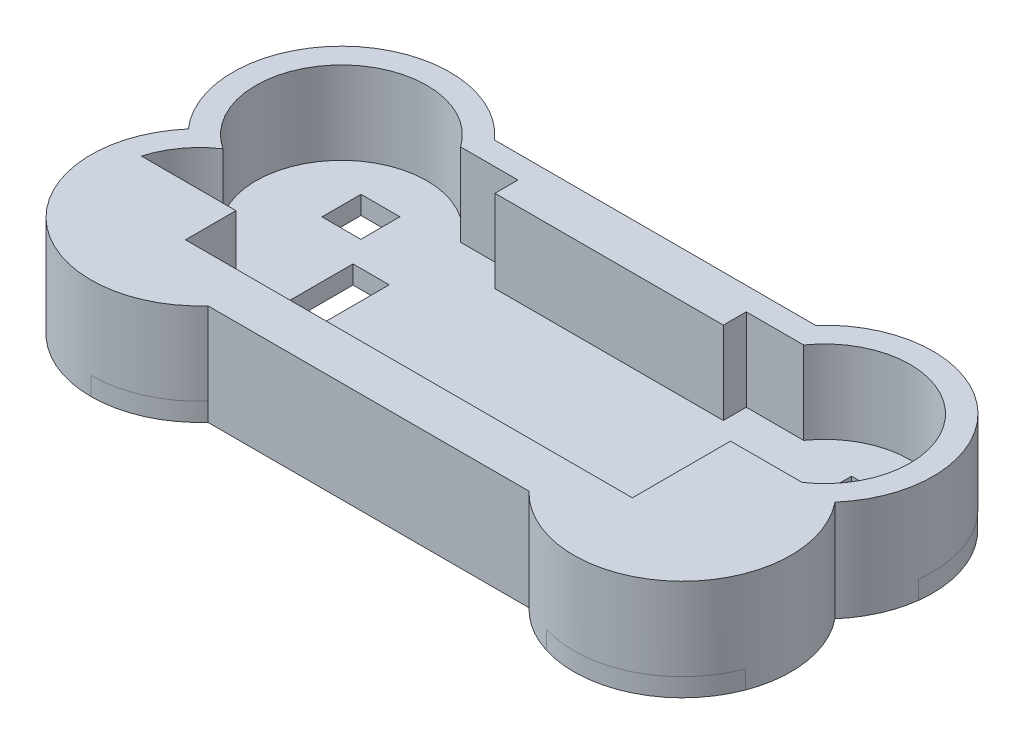
from build123d import *

# Parameters (mm, degrees)
SKETCH1_W               = 25.267998504
SKETCH1_H               = 2.54
BOSS_EXTRUDE7_DEPTH     = 9.144
BOSS_EXTRUDE9_START     = -2.032
BOSS_EXTRUDE9_OUTLINE_W = 4.303574795
BOSS_EXTRUDE9_OUTLINE_H = 4.327328355
BOSS_EXTRUDE9_DEPTH     = 2.032


# Read off the part's stored shape, not the designer's step: Boss-Extrude9
with BuildPart() as part:
    # Sketch1 → Boss-Extrude7 (new body)
    # profile 1 of 5: a face of its own
    with BuildSketch(Plane(origin=(0, 0, 0), x_dir=(1, 0, 0), z_dir=(0, 1, 0))):
        with BuildLine():
            ThreePointArc((20.091392362, -14.973938339), (36.674866164, -15.633001334), (38.077226225, 0.904209847))
            ThreePointArc((38.077226225, 0.904209847), (36.965236291, 17.810596862), (20.053933255, 16.7760568))
            Line((20.053933255, 16.7760568), (-15.464178996, 16.7760568))
            ThreePointArc((-15.464178996, 16.7760568), (-32.391267437, 17.810916917), (-33.472263124, 0.886712153))
            ThreePointArc((-33.472263124, 0.886712153), (-32.31789128, -15.981799893), (-15.439991882, -14.973938339))
            Line((-15.439991882, -14.973938339), (20.091392362, -14.973938339))
        make_face()
        with BuildLine():
            ThreePointArc((-29.65629843, 0.90105923), (-31.167264268, -13.573979358), (-16.658299233, -12.433938339))
            Line((-16.658299233, -12.433938339), (21.246557929, -12.433938339))
            ThreePointArc((21.246557929, -12.433938339), (35.496314389, -13.251428184), (34.363784281, 0.976755972))
            ThreePointArc((34.363784281, 0.976755972), (35.768086185, 15.449459714), (21.2781286, 14.2360568))
            Line((21.2781286, 14.2360568), (-16.689869904, 14.2360568))
            ThreePointArc((-16.689869904, 14.2360568), (-31.234591455, 15.407251461), (-29.65629843, 0.90105923))
        make_face(mode=Mode.SUBTRACT)
    # profile 2 of 5: a face of its own
    with BuildSketch(Plane(origin=(0, 0, 0), x_dir=(1, 0, 0), z_dir=(0, 1, 0))):
        with BuildLine():
            ThreePointArc((-33.474089865, -4.305938339), (-28.507587271, -15.489738966), (-16.658299233, -12.433938339))
            Line((-16.658299233, -12.433938339), (-10.339869904, -12.433938339))
            Line((-10.339869904, -12.433938339), (-10.339869904, -9.893938339))
            Line((-10.339869904, -9.893938339), (-16.658299233, -9.893938339))
            Line((-16.658299233, -9.893938339), (-23.008299233, -9.893938339))
            Line((-23.008299233, -9.893938339), (-23.008299233, -4.305938339))
            Line((-23.008299233, -4.305938339), (-33.474089865, -4.305938339))
        make_face()
    # profile 3 of 5: a face of its own
    with BuildSketch(Plane(origin=(0, 0, 0), x_dir=(1, 0, 0), z_dir=(0, 1, 0))):
        with Locations((2.294129348, -11.163938339)):
            Rectangle(SKETCH1_W, SKETCH1_H)
    # profile 4 of 5: a face of its own
    with BuildSketch(Plane(origin=(0, 0, 0), x_dir=(1, 0, 0), z_dir=(0, 1, 0))):
        with BuildLine():
            Line((14.9281286, -9.893938339), (14.9281286, -12.433938339))
            Line((14.9281286, -12.433938339), (21.246557929, -12.433938339))
            ThreePointArc((21.246557929, -12.433938339), (35.496314389, -13.251428184), (34.363784281, 0.976755972))
            Line((34.363784281, 0.976755972), (26.449874225, 0.976755972))
            Line((26.449874225, 0.976755972), (26.449874225, -9.893938339))
            Line((26.449874225, -9.893938339), (21.246557929, -9.893938339))
            Line((21.246557929, -9.893938339), (14.9281286, -9.893938339))
        make_face()
    # profile 5 of 5: a face of its own
    with BuildSketch(Plane(origin=(0, 0, 0), x_dir=(1, 0, 0), z_dir=(0, 1, 0))):
        with Locations((2.294129348, 12.9660568)):
            Rectangle(SKETCH1_W, SKETCH1_H)
    extrude(amount=BOSS_EXTRUDE7_DEPTH)

    # Boss-Extrude9 outline → Boss-Extrude9 (add)
    with BuildSketch(Plane(origin=(0, 0, 2.54), x_dir=(-1, 0, 0), z_dir=(0, 1, 0)).offset(BOSS_EXTRUDE9_START)):
        with BuildLine():
            ThreePointArc((-39.962274592, 8.331071624), (-40.584803359, 2.192889064), (-38.077226225, -3.444209847))
            ThreePointArc((-38.077226225, -3.444209847), (-39.980253201, -6.412725487), (-40.938977335, -9.806019581))
            ThreePointArc((-40.938977335, -9.806019581), (-34.00622148, -22.23363184), (-20.077959401, -19.316070247))
            Line((-20.077959401, -19.316070247), (-20.053939231, -19.316070247))
            Line((-20.053939231, -19.316070247), (15.464178996, -19.3160568))
            ThreePointArc((15.464178996, -19.3160568), (16.013662974, -19.895397798), (16.600434504, -20.436939861))
            ThreePointArc((16.600434504, -20.436939861), (32.922411354, -19.767481007), (33.473277412, -3.441071419))
            ThreePointArc((33.473277412, -3.441071419), (33.476154659, -3.437751763), (33.47903069, -3.434431054))
            ThreePointArc((33.47903069, -3.434431054), (33.475647732, -3.43057088), (33.472263124, -3.426712153))
            ThreePointArc((33.472263124, -3.426712153), (35.310098705, 9.413648761), (24.402438556, 16.433296764))
            ThreePointArc((24.402438556, 16.433296764), (19.501273126, 15.38830994), (15.453425616, 12.433931737))
            Line((15.453425616, 12.433931737), (-20.091392362, 12.433938339))
            ThreePointArc((-20.091392362, 12.433938339), (-22.408655082, 14.301808135), (-25.114144013, 15.542361937))
            ThreePointArc((-25.114144013, 15.542361937), (-33.970966426, 14.886780351), (-39.962274592, 8.331071624))
        make_face()
        with Locations((-29.515589711, -13.831402182)):
            Rectangle(BOSS_EXTRUDE9_OUTLINE_W, BOSS_EXTRUDE9_OUTLINE_H, mode=Mode.SUBTRACT)
        with Locations((24.644768928, -13.703519078)):
            Rectangle(BOSS_EXTRUDE9_OUTLINE_W, BOSS_EXTRUDE9_OUTLINE_H, mode=Mode.SUBTRACT)
        Polygon((32.612403312, 1.632473231), (32.612403312, -1.682770742), (20.573249237, -1.682770742), (20.573249237, -8.754579205), (16.565180299, -8.754579205), (16.565180299, 0.209107335), (20.573249237, 0.209107335), (20.573249237, 1.632473231), align=None, mode=Mode.SUBTRACT)
    extrude(amount=BOSS_EXTRUDE9_DEPTH)


solid = part.part
